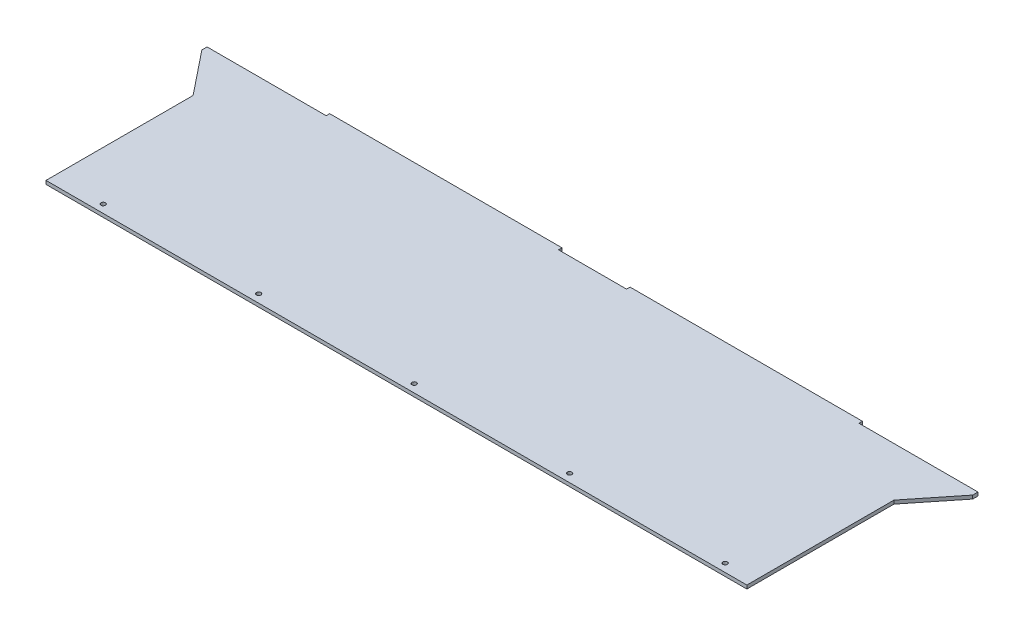
from build123d import *

# Parameters (mm, degrees)
SKETCH1_W           = 635.3556
SKETCH1_H           = 177.8
BOSS_EXTRUDE1_DEPTH = 1.5875
SKETCH2_W           = 210.6549
SKETCH2_H           = 3.175
BOSS_EXTRUDE2_DEPTH = 3.175
BOSS_EXTRUDE3_DEPTH = 3.175
SKETCH4_R           = 2.025
CUT_EXTRUDE1_DEPTH  = 10
LPATTERN1_COUNT     = 5
LPATTERN1_PITCH     = 140.97


with BuildPart() as part:
    # Sketch1 → Boss-Extrude1 (new, symmetric)
    with BuildSketch(Plane(origin=(0, 0, 0), x_dir=(1, 0, 0), z_dir=(0, 1, 0))):
        Rectangle(SKETCH1_W, SKETCH1_H)
    extrude(amount=BOSS_EXTRUDE1_DEPTH, both=True)

    # Sketch2 → Boss-Extrude2 (add)
    with BuildSketch(Plane(origin=(0, 0, -88.9), x_dir=(-1, 0, 0), z_dir=(0, 0, -1))):
        with Locations((136.15035, 0)):
            Rectangle(SKETCH2_W, SKETCH2_H)
        with Locations((-136.15035, 0)):
            Rectangle(SKETCH2_W, SKETCH2_H)
    extrude(amount=BOSS_EXTRUDE2_DEPTH)

    # Sketch3 → Boss-Extrude3 (add)
    with BuildSketch(Plane(origin=(0, 1.5875, 0), x_dir=(1, 0, 0), z_dir=(0, 1, 0))):
        Polygon((-317.6778, 44.45), (-317.6778, 88.9), (-349.4278, 88.9), (-349.4278, 84.1375), align=None)
    boss_extrude3 = extrude(amount=-BOSS_EXTRUDE3_DEPTH)

    # Mirror1: Boss-Extrude3 across plane
    add(boss_extrude3.mirror(Plane(origin=(0, 0, 0), x_dir=(0, 0, 1), z_dir=(1, 0, 0))))

    # Sketch4 → Cut-Extrude1 (cut)
    with BuildSketch(Plane(origin=(0, 1.5875, 0), x_dir=(1, 0, 0), z_dir=(0, 1, 0))):
        with Locations((-273.2278, -81.534)):
            Circle(SKETCH4_R)
    cut_extrude1 = extrude(amount=-CUT_EXTRUDE1_DEPTH, mode=Mode.SUBTRACT)

    # LPattern1: Cut-Extrude1 ×5
    with Locations(*[(i * LPATTERN1_PITCH, 0, 0) for i in range(1, LPATTERN1_COUNT)]):
        add(cut_extrude1, mode=Mode.SUBTRACT)


solid = part.part
